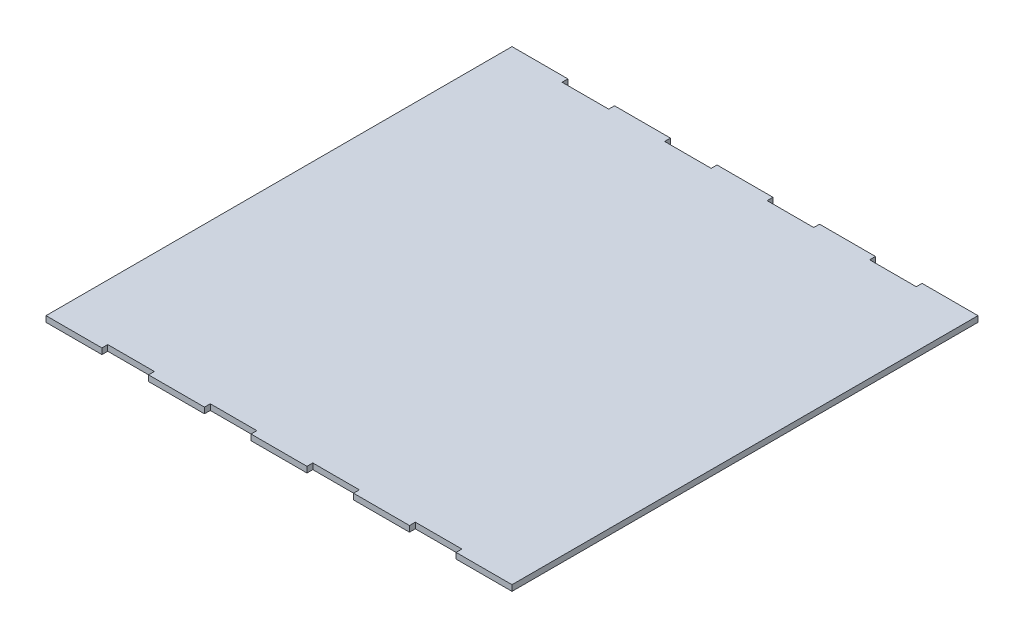
from build123d import *

# Parameters (mm, degrees)
SKIZZE1_W                       = 400
SKIZZE1_H                       = 400
GRUNDPLATTE_DEPTH               = 5
SKIZZE2_W                       = 40
SKIZZE2_H                       = 5
SCHNITT_LINEAR_AUSTRAGEN1_DEPTH = 283.886903196


with BuildPart() as part:
    # Skizze1 → Grundplatte (new body)
    with BuildSketch(Plane(origin=(0, 0, 0), x_dir=(1, 0, 0), z_dir=(0, 1, 0))):
        Rectangle(SKIZZE1_W, SKIZZE1_H)
    extrude(amount=GRUNDPLATTE_DEPTH)

    # Skizze2 → Schnitt-Linear austragen1 (cut, through all)
    with BuildSketch(Plane(origin=(0, 5, 0), x_dir=(1, 0, 0), z_dir=(0, 1, 0))):
        with Locations((-132, 197.5)):
            Rectangle(SKIZZE2_W, SKIZZE2_H)
        with Locations((-44, 197.5)):
            Rectangle(SKIZZE2_W, SKIZZE2_H)
        with Locations((44, 197.5)):
            Rectangle(SKIZZE2_W, SKIZZE2_H)
        with Locations((132, 197.5)):
            Rectangle(SKIZZE2_W, SKIZZE2_H)
    schnitt_linear_austragen1 = extrude(amount=-SCHNITT_LINEAR_AUSTRAGEN1_DEPTH, mode=Mode.SUBTRACT)

    # Spiegeln1: Schnitt-Linear austragen1 across plane
    add(schnitt_linear_austragen1.mirror(Plane.XY), mode=Mode.SUBTRACT)


solid = part.part
